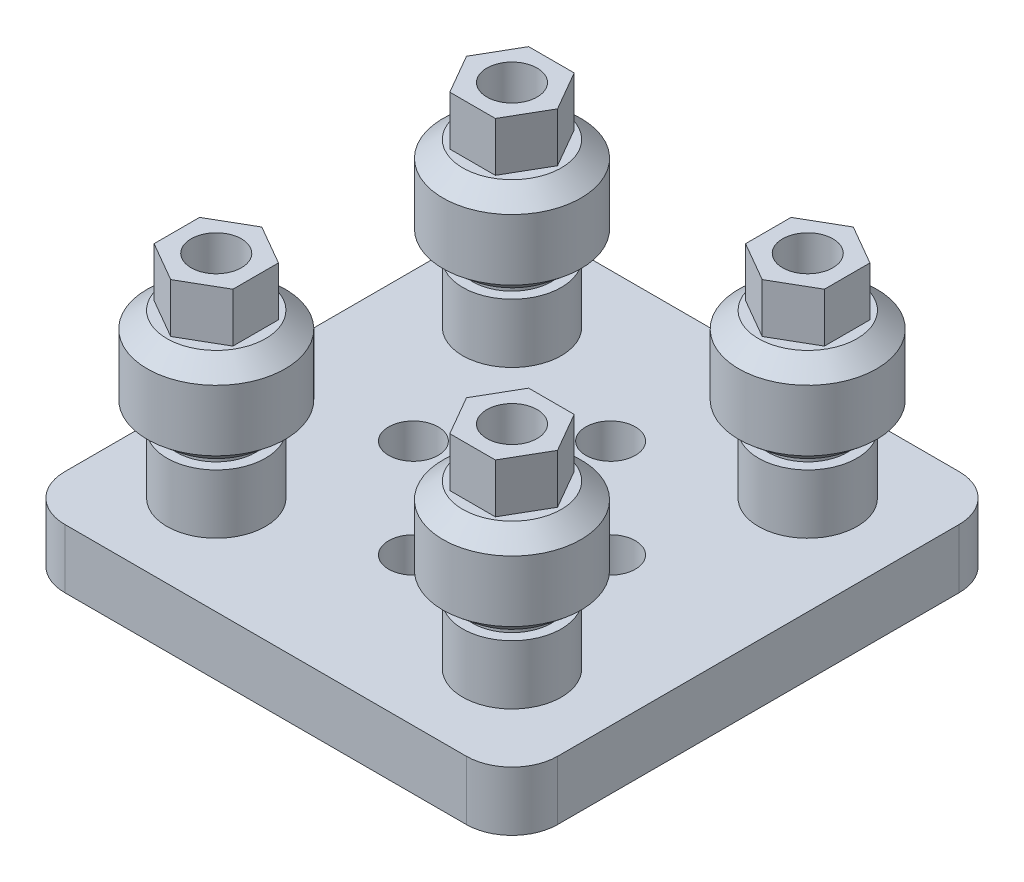
from build123d import *
from build123d.topology import SkipClean

# Parameters (mm, degrees)
SKETCH_1_R                = 3.6
SKETCH_1_R_2              = 2.55
SKETCH_1_R_3              = 2.51
EXTRUDE_1_DEPTH           = 6
SKETCH_2_R                = 6
SKETCH_2_R_2              = 5.05
CUT_EXTRUDE_1_DEPTH       = 2
SKETCH_3_R                = 5
SKETCH_3_R_2              = 2.55
EXTRUDE_1653_DEPTH        = 6
SKETCH_4_R                = 4
SKETCH_4_R_2              = 2.55
EXTRUDE_1789_DEPTH        = 1
SKETCH_6_R                = 2.55
EXTRUDE_2406_DEPTH        = 5
PATTERN_CIRCULAR_10_COUNT = 4


with BuildPart() as part:
    # Эскиз1 → Бобышка-Вытянуть1 (new body)
    with BuildSketch(Plane(origin=(0, 0, 0), x_dir=(1, 0, 0), z_dir=(0, 1, 0))):
        with BuildLine():
            Line((20.359997187, -25), (-20.36, -25))
            ThreePointArc((-20.36, -25), (-23.640976459, -23.64097447), (-25, -20.359997187))
            Line((-25, -20.359997187), (-25, 20.36))
            ThreePointArc((-25, 20.36), (-23.64097447, 23.640976459), (-20.359997187, 25))
            Line((-20.359997187, 25), (20.36, 25))
            ThreePointArc((20.36, 25), (23.640976459, 23.64097447), (25, 20.359997187))
            Line((25, 20.359997187), (25, -20.36))
            ThreePointArc((25, -20.36), (23.64097447, -23.640976459), (20.359997187, -25))
        make_face()
        with Locations((-15, 15)):
            Circle(SKETCH_1_R, mode=Mode.SUBTRACT)
        with Locations((15, 15)):
            Circle(SKETCH_1_R, mode=Mode.SUBTRACT)
        with Locations((15, -15)):
            Circle(SKETCH_1_R_2, mode=Mode.SUBTRACT)
        with Locations((-15, -15)):
            Circle(SKETCH_1_R_2, mode=Mode.SUBTRACT)
        Circle(SKETCH_1_R_3, mode=Mode.SUBTRACT)
        with Locations((0, 10)):
            Circle(SKETCH_1_R_3, mode=Mode.SUBTRACT)
        with Locations((10, 0)):
            Circle(SKETCH_1_R_3, mode=Mode.SUBTRACT)
        with Locations((0, -10)):
            Circle(SKETCH_1_R_3, mode=Mode.SUBTRACT)
        with Locations((-10, 0)):
            Circle(SKETCH_1_R_3, mode=Mode.SUBTRACT)
    extrude(amount=EXTRUDE_1_DEPTH)

    # Эскиз2 → Вырез-Вытянуть1 (cut)
    with BuildSketch(Plane(origin=(0, 0, 0), x_dir=(1, 0, 0), z_dir=(0, 1, 0))):
        with Locations((-15, 15)):
            Circle(SKETCH_2_R)
        with Locations((15, 15)):
            Circle(SKETCH_2_R)
        with Locations((-15, -15)):
            Circle(SKETCH_2_R_2)
        with Locations((15, -15)):
            Circle(SKETCH_2_R_2)
    extrude(amount=CUT_EXTRUDE_1_DEPTH, mode=Mode.SUBTRACT)


with BuildPart() as body_2:
    # Эскиз3 → Extrude 1653 (new body)
    with BuildSketch(Plane(origin=(0, 6, 0), x_dir=(1, 0, 0), z_dir=(0, 1, 0))):
        with Locations((-15, 15)):
            Circle(SKETCH_3_R)
        with Locations((-15, 15)):
            Circle(SKETCH_3_R_2, mode=Mode.SUBTRACT)
    extrude(amount=EXTRUDE_1653_DEPTH)

    # Эскиз4 → Extrude 1789 (add)
    with BuildSketch(Plane(origin=(0, 12, 0), x_dir=(1, 0, 0), z_dir=(0, 1, 0))):
        with Locations((-15, 15)):
            Circle(SKETCH_4_R)
        with Locations((-15, 15)):
            Circle(SKETCH_4_R_2, mode=Mode.SUBTRACT)
    extrude(amount=EXTRUDE_1789_DEPTH)

    # Эскиз5 → Revolve 2225 (revolve)
    with BuildSketch(Plane(origin=(-15, 0, 0), x_dir=(0, 0, -1), z_dir=(1, 0, 0))):
        Polygon((17.55, 13), (17.55, 22.5), (20, 22.5), (22, 20.85), (22, 14.65), (20, 13), align=None)
    revolve(axis=Axis((-15, 13, -15), (0, 1, 0)))

    # Эскиз6 → Extrude 2406 (add)
    with SkipClean():  # the faces are left unmerged after this step: merging them gives an invalid solid
        with BuildSketch(Plane(origin=(0, 22.5, 0), x_dir=(1, 0, 0), z_dir=(0, 1, 0))):
            Polygon((-17.309401077, 11), (-19.618802154, 15), (-17.309401077, 19), (-12.690598923, 19), (-10.381197846, 15), (-12.690598923, 11), align=None)
            with Locations((-15, 15)):
                Circle(SKETCH_6_R, mode=Mode.SUBTRACT)
        extrude(amount=EXTRUDE_2406_DEPTH)
    add(body_2.part.scale(1), mode=Mode.REPLACE)  # the faces are merged on a copy


with BuildPart() as pattern_circular_10_1:
    # Круговой массив10: pattern copy
    add(body_2.part.rotate(Axis((0, 6, 0), (0, -1, 0)), 1 * 360 / PATTERN_CIRCULAR_10_COUNT))


with BuildPart() as pattern_circular_10_2:
    # Круговой массив10: pattern copy
    add(body_2.part.rotate(Axis((0, 6, 0), (0, -1, 0)), 2 * 360 / PATTERN_CIRCULAR_10_COUNT))


with BuildPart() as pattern_circular_10_3:
    # Круговой массив10: pattern copy
    add(body_2.part.rotate(Axis((0, 6, 0), (0, -1, 0)), 3 * 360 / PATTERN_CIRCULAR_10_COUNT))


solid = Compound([part.part, body_2.part, pattern_circular_10_1.part, pattern_circular_10_2.part, pattern_circular_10_3.part])
